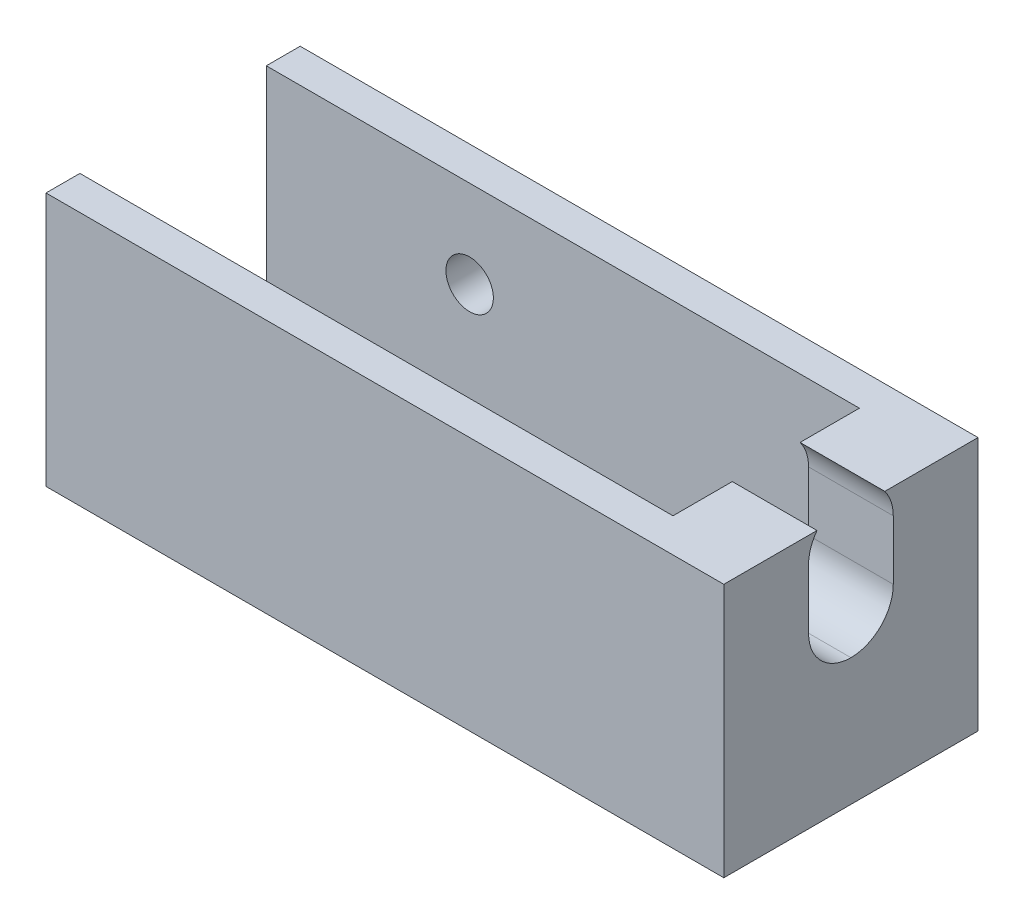
from build123d import *

# Parameters (mm, degrees)
SKETCH1_W           = 40
SKETCH1_H           = 15
BOSS_EXTRUDE1_DEPTH = 15
CUT_EXTRUDE1_DEPTH  = 5
CUT_EXTRUDE2_DEPTH  = 13
FILLET3_R           = 2.5
FILLET4_R           = 2.5
SKETCH4_R           = 1.4
CUT_EXTRUDE3_DEPTH  = 8
SKETCH5_R           = 1
CUT_EXTRUDE4_DEPTH  = 10


with BuildPart() as part:
    # Sketch1 → Boss-Extrude1 (new body)
    with BuildSketch(Plane(origin=(0, 0, 0), x_dir=(1, 0, 0), z_dir=(0, 1, 0))):
        Rectangle(SKETCH1_W, SKETCH1_H)
    extrude(amount=BOSS_EXTRUDE1_DEPTH)

    # Sketch2 → Cut-Extrude1 (cut)
    with BuildSketch(Plane(origin=(20, 0, 0), x_dir=(0, 0, -1), z_dir=(1, 0, 0))):
        with BuildLine():
            Line((-2.5, 13.5), (-2.5, 7.5))
            Line((-2.5, 7.5), (2.5, 7.5))
            Line((2.5, 7.5), (2.5, 13.5))
            ThreePointArc((2.5, 13.5), (0, 16), (-2.5, 13.5))
        make_face()
    extrude(amount=-CUT_EXTRUDE1_DEPTH, mode=Mode.SUBTRACT)

    # Sketch3 → Cut-Extrude2 (cut)
    with BuildSketch(Plane(origin=(0, 15, 0), x_dir=(1, 0, 0), z_dir=(0, 1, 0))):
        Polygon((-18, 5.5), (-20, 5.5), (-20, -5.5), (-18, -5.5), (15, -5.5), (15, 2), (15, 5.5), align=None)
    extrude(amount=-CUT_EXTRUDE2_DEPTH, mode=Mode.SUBTRACT)

    # Fillet3
    fillet3_edges = [part.edges().sort_by_distance(p)[0] for p in [
        (17.5, 7.5, -2.5),
    ]]
    fillet(fillet3_edges, radius=FILLET3_R)

    # Fillet4
    fillet4_edges = [part.edges().sort_by_distance(p)[0] for p in [
        (17.5, 7.5, 2.5),
    ]]
    fillet(fillet4_edges, radius=FILLET4_R - 0.0001)  # a hair under: the kernel refuses the full size

    # Sketch4 → Cut-Extrude3 (cut)
    with BuildSketch(Plane(origin=(-14.629961684, 3.541693354, -7.5), x_dir=(-1, 0, 0), z_dir=(0, 0, -1))):
        with Locations((-6.629961684, 6.289794724)):
            Circle(SKETCH4_R)
    extrude(amount=-CUT_EXTRUDE3_DEPTH, mode=Mode.SUBTRACT)

    # Sketch5 → Cut-Extrude4 (cut)
    with BuildSketch(Plane(origin=(0, 2, 0), x_dir=(1, 0, 0), z_dir=(0, 1, 0))):
        with Locations(Location((-15.932700141, 0, 0), (0, 0, 270))):
            Circle(SKETCH5_R)
    extrude(amount=-CUT_EXTRUDE4_DEPTH, mode=Mode.SUBTRACT)


solid = part.part
